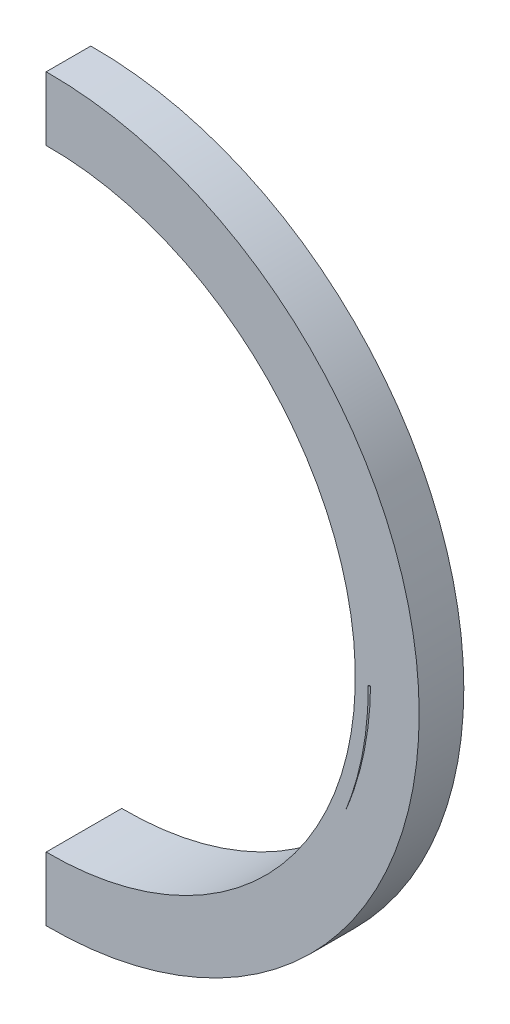
from build123d import *

# Parameters (mm, degrees)
SKETCH1_R           = 53.85
SKETCH1_R_2         = 44.55
BOSS_EXTRUDE1_DEPTH = 6.5
BOSS_EXTRUDE2_START = 4.5
SKETCH2_R           = 46.55
SKETCH2_R_2         = 44.55
BOSS_EXTRUDE2_DEPTH = 4.5
THREAD1_PITCH       = 2
CUT_EXTRUDE1_DEPTH  = 77.945752542


with BuildPart() as part:
    # Sketch1 → Boss-Extrude1 (new body)
    with BuildSketch(Plane.XY):
        with Locations(Location((0, 0, 0), (0, 0, 180))):
            Circle(SKETCH1_R)
        with Locations(Location((0, 0, 0), (0, 0, 180))):
            Circle(SKETCH1_R_2, mode=Mode.SUBTRACT)
    extrude(amount=BOSS_EXTRUDE1_DEPTH)

    # Sketch2 → Boss-Extrude2 (add)
    with BuildSketch(Plane(origin=(0, 0, 0), x_dir=(-1, 0, 0), z_dir=(0, 0, -1)).offset(BOSS_EXTRUDE2_START)):
        with Locations(Location((0, 0, 0), (0, 0, 180))):
            Circle(SKETCH2_R)
        Circle(SKETCH2_R_2, mode=Mode.SUBTRACT)
    extrude(amount=-BOSS_EXTRUDE2_DEPTH)

    # Thread1: the profile of Thread Profile1 profile screwed along a right-hand helix of 5 turns, 10 arcs to a turn; built about Z, then put on its axis
    thread1_z = Axis((0, 0, 0), (0, 0, 1))
    thread1_corners = [(46.5497, 0, -0.000173205), (47.361898813, 0, 0.468749998), (47.361898813, 0, 0.656249998), (46.5497, 0, 1.125173201)]
    with BuildLine(mode=Mode.PRIVATE) as thread1_profile:
        Line(thread1_corners[0], thread1_corners[1])
        Line(thread1_corners[1], thread1_corners[2])
        Line(thread1_corners[2], thread1_corners[3])
        Line(thread1_corners[3], thread1_corners[0])
    thread1_cap = Face(thread1_profile.wire())
    thread1_turn_angles = [0, 18, 36, 54, 72, 90, 108, 126, 144, 162, 180, 198, 216, 234, 252, 270, 288, 306, 324, 342, 360]
    thread1_turn_weights = [1, 0.9510565162951535, 1, 0.9510565162951535, 1, 0.9510565162951535, 1, 0.9510565162951535, 1, 0.9510565162951535, 1, 0.9510565162951535, 1, 0.9510565162951535, 1, 0.9510565162951535, 1, 0.9510565162951535, 1, 0.9510565162951535, 1]
    thread1_turn_rails = [Edge.make_bspline([Vector(p[0], p[1], 0).rotate(thread1_z, thread1_turn_angles[k]) / thread1_turn_weights[k] + Vector(0, 0, p[2] + THREAD1_PITCH * thread1_turn_angles[k] / 360) for k in range(21)], [0, 0, 0, 1, 1, 2, 2, 3, 3, 4, 4, 5, 5, 6, 6, 7, 7, 8, 8, 9, 9, 10, 10, 10], 2, thread1_turn_weights) for p in thread1_corners]
    thread1_turn_sides = [Face.make_surface_from_curves(thread1_turn_rails[p[0]], thread1_turn_rails[p[1]]) for p in [(0, 1), (1, 2), (2, 3), (3, 0)]]
    thread1 = Plane(origin=(0, 0, -4.5), x_dir=(1, 0, 0), z_dir=(0, 0, 1)) * Solid(Shell([*[p.moved(Location((0, 0, THREAD1_PITCH * i))) for i in range(5) for p in thread1_turn_sides], thread1_cap, thread1_cap.rotate(thread1_z, 1800).moved(Location((0, 0, THREAD1_PITCH * 1800 / 360)))]))
    add(thread1)

    # Sketch5 → Cut-Extrude1 (cut, through all)
    with BuildSketch(Plane.XY.offset(6.5)):
        with BuildLine():
            ThreePointArc((-0.464567884, 53.847996032), (-53.85, 0), (-0.464567884, -53.847996032))
            Line((-0.464567884, -53.847996032), (-0.464567884, -44.547577675))
            ThreePointArc((-0.464567884, -44.547577675), (-44.55, 0), (-0.464567884, 44.547577675))
            Line((-0.464567884, 44.547577675), (-0.464567884, 53.847996032))
        make_face()
    extrude(amount=-CUT_EXTRUDE1_DEPTH, mode=Mode.SUBTRACT)


solid = part.part
